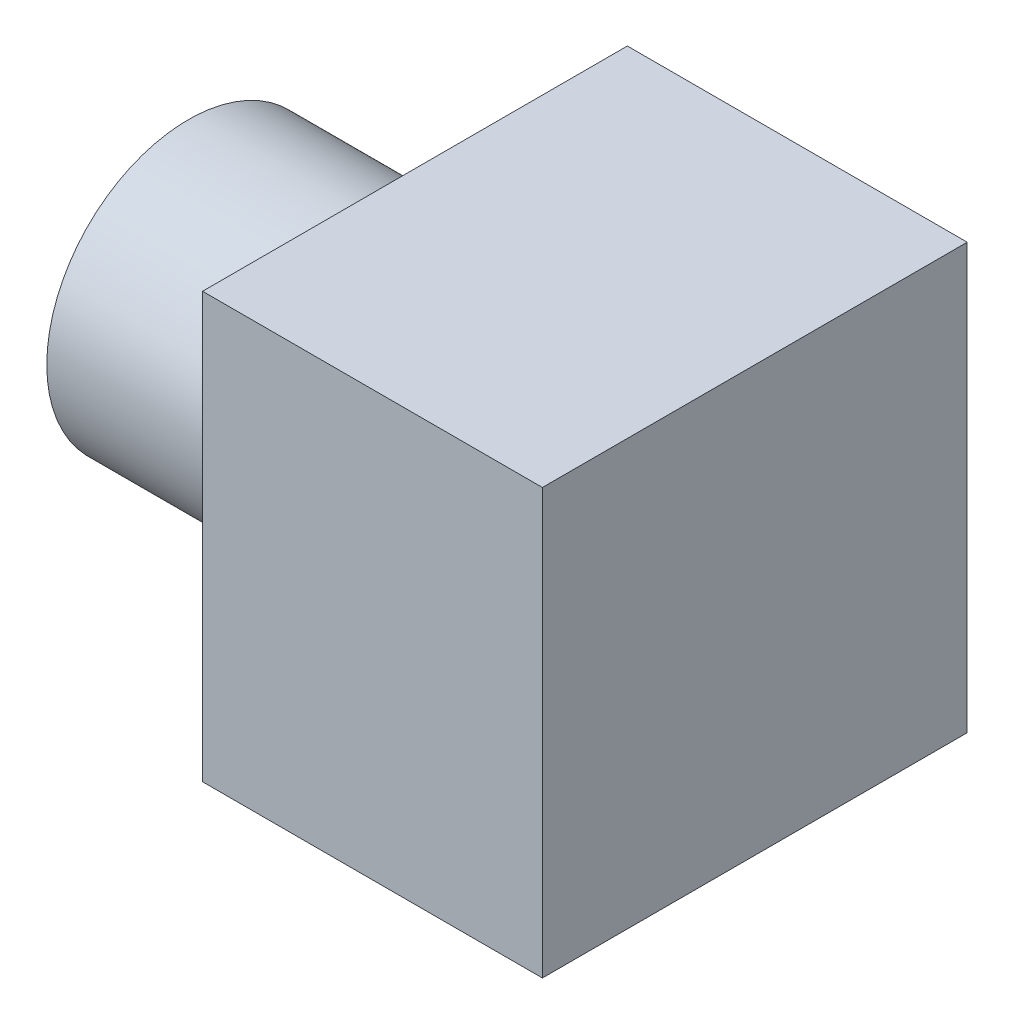
from build123d import *

# Parameters (mm, degrees)
SKETCH2_R           = 5
BOSS_EXTRUDE1_DEPTH = 8
SKETCH3_W           = 15
SKETCH3_H           = 15
BOSS_EXTRUDE2_DEPTH = 12
SKETCH4_R           = 4
CUT_EXTRUDE1_DEPTH  = 1


with BuildPart() as part:
    # Sketch2 → Boss-Extrude1 (new body)
    with BuildSketch(Plane.ZY.offset(36.137829577)):
        with Locations((-25, -31.600577771)):
            Circle(SKETCH2_R)
    extrude(amount=BOSS_EXTRUDE1_DEPTH)

    # Sketch3 → Boss-Extrude2 (add)
    with BuildSketch(Plane(origin=(-36.137829577, 0, 0), x_dir=(0, 0, -1), z_dir=(1, 0, 0))):
        with Locations((25, -31.600577771)):
            Rectangle(SKETCH3_W, SKETCH3_H)
    extrude(amount=BOSS_EXTRUDE2_DEPTH)

    # Sketch4 → Cut-Extrude1 (cut)
    with BuildSketch(Plane.ZY.offset(44.137829577)):
        with Locations((-25, -31.600577771)):
            Circle(SKETCH4_R)
    extrude(amount=-CUT_EXTRUDE1_DEPTH, mode=Mode.SUBTRACT)


solid = part.part
